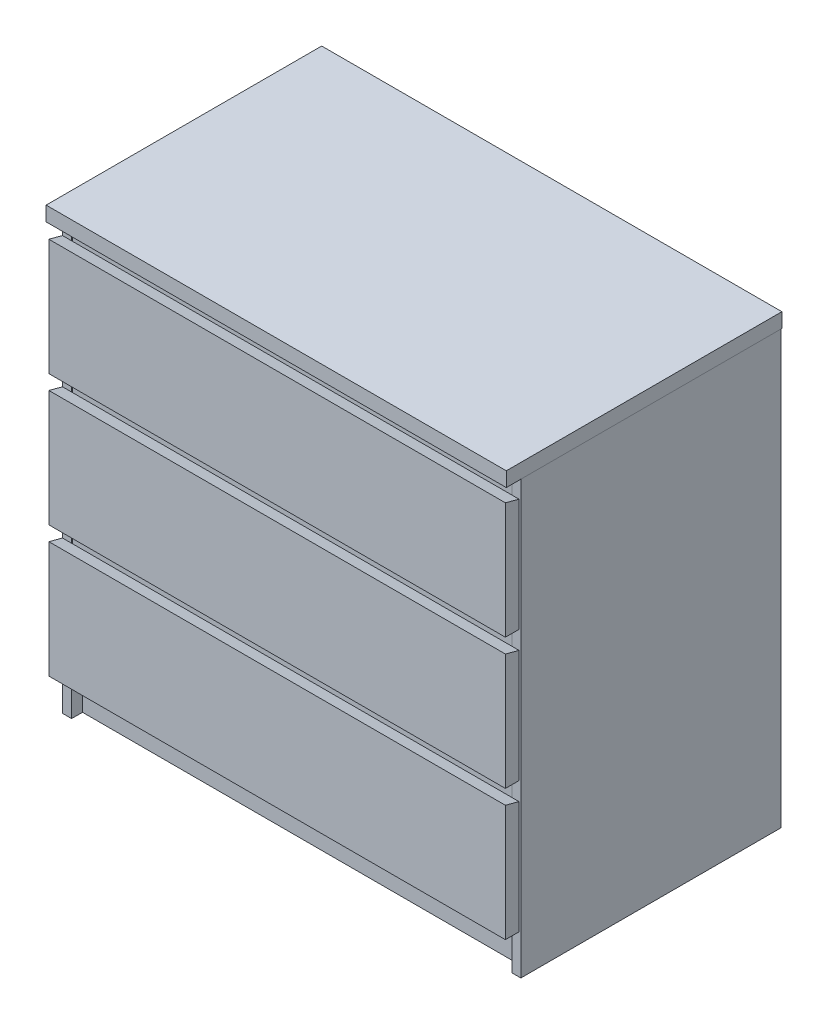
from build123d import *

# Parameters (mm, degrees)
BASESECTIONSIDESBOSS_EXTRUDE_DEPTH       = 69.85
BASESECTIONSIDESBOSS_EXTRUDE_2_DEPTH     = 69.85
PLANSKETCH_3_W                           = 768.35
PLANSKETCH_3_H                           = 15.875
BASEFACEEXTRUDE_THIN_DEPTH               = 69.85
F_1STLEVSIDESSECTIONBOSS_EXTRUDE_START   = 69.85
F_1STLEVSIDESSECTIONBOSS_EXTRUDE_DEPTH   = 228.6
F_1STLEVSIDESSECTIONBOSS_EXTRUDE_2_DEPTH = 228.6
F_1STLEVFRONTBAREXTRUDE_THIN_START       = 260.35
PLANSKETCH_5_W                           = 800.1
PLANSKETCH_5_H                           = 15.875
F_1STLEVFRONTBAREXTRUDE_THIN_DEPTH       = 38.1
DRAWERFACEBOSS_EXTRUDE_START             = 69.85
PLANSKETCH_6_W                           = 768.35
PLANSKETCH_6_H                           = 25.4
PLANSKETCH_6_W_2                         = 15.875
DRAWERFACEBOSS_EXTRUDE_DEPTH             = 203.2
POSITIONINGMOVE_FACE_BY                  = 1.5875
POSITIONINGMOVE_FACE_2_BY                = 1.5875
POSITIONINGMOVE_FACE_3_BY                = 1.5875
POSITIONINGMOVE_FACE_4_BY                = 1.5875
DRAWERPULLTOPMOVE_START                  = 263.746046868
DRAWERPULLTOPMOVE_FACE_OUTLINE_W         = 800
DRAWERPULLTOPMOVE_FACE_OUTLINE_H         = 27
DRAWERPULLTOPMOVE_FACE_DEPTH             = 6.163128512
BASEBACKBEAMBOSS_EXTRUDE_START           = 44.45
PLANSKETCH_8_W                           = 768.35
PLANSKETCH_8_H                           = 50.8
BASEBACKBEAMBOSS_EXTRUDE_DEPTH           = 15.875
DRAWERBODYBOSS_EXTRUDE_START             = 82.55
PLANSKETCH_9_W                           = 768.35
PLANSKETCH_9_H                           = 381
PLANSKETCH_9_H_2                         = 19.05
DRAWERBODYBOSS_EXTRUDE_DEPTH             = 158.75
DRAWERBODYSHELL_T                        = -12.7
DRAWERSIDESMOVE_FACE_BY                  = 3.175
DRAWERSIDESMOVE_FACE_2_BY                = 3.175
DRAWERSIDESMOVE_FACE_3_BY                = 3.175
DRAWERMERGEMOVE_START                    = -25.4
DRAWERMERGEMOVE_FACE_DEPTH               = 12.7
HEIGHTLPATTERN_COUNT                     = 3
HEIGHTLPATTERN_PITCH                     = 228.6
TOPBOARDBOSS_EXTRUDE_START               = 781.05
PLANSKETCH_10_W                          = 800.1
PLANSKETCH_10_H                          = 479.425
TOPBOARDBOSS_EXTRUDE_DEPTH               = 25.4
BACKBOARDEXTRUDE_THIN_START              = 44.45
PLANSKETCH_11_W                          = 768.35
PLANSKETCH_11_H                          = 1.5875
BACKBOARDEXTRUDE_THIN_DEPTH              = 711.2
TOPBOARDEXPANDMOVE_FACE_BY               = 1.5875
TOPBOARDEXPANDMOVE_FACE_2_BY             = 1.5875
TOPBOARDEXPANDMOVE_FACE_3_BY             = 1.5875


# Read off the part's stored shape, not the designer's step: DrawerPullTopMove Face, DrawerMergeMove Face
with BuildPart() as part:
    # PlanSketch → BaseSectionSidesBoss-Extrude (new body)
    with BuildSketch(Plane(origin=(0, 0, 0), x_dir=(1, 0, 0), z_dir=(0, 1, 0))):
        Polygon((800.1, 479.425), (784.225, 479.425), (784.225, 476.25), (784.225, 425.45), (784.225, 44.45), (784.225, 25.4), (800.1, 25.4), align=None)
    extrude(amount=BASESECTIONSIDESBOSS_EXTRUDE_DEPTH)



with BuildPart() as body_2:
    # PlanSketch → BaseSectionSidesBoss-Extrude 2 (new body)
    with BuildSketch(Plane(origin=(0, 0, 0), x_dir=(1, 0, 0), z_dir=(0, 1, 0))):
        Polygon((15.875, 476.25), (15.875, 479.425), (0, 479.425), (0, 25.4), (15.875, 25.4), (15.875, 44.45), (15.875, 425.45), align=None)
    extrude(amount=BASESECTIONSIDESBOSS_EXTRUDE_2_DEPTH)


with BuildPart() as part_1:
    add(part.part)

    add(body_2.part)  # BaseFaceExtrude-Thin merges body 2
    # PlanSketch<3> → BaseFaceExtrude-Thin (add)
    with BuildSketch(Plane(origin=(0, 0, 0), x_dir=(1, 0, 0), z_dir=(0, 1, 0))):
        with Locations((400.05, 52.3875)):
            Rectangle(PLANSKETCH_3_W, PLANSKETCH_3_H)
    extrude(amount=BASEFACEEXTRUDE_THIN_DEPTH)

    # PlanSketch<8> → BaseBackBeamBoss-Extrude (add)
    with BuildSketch(Plane(origin=(0, 0, 0), x_dir=(1, 0, 0), z_dir=(0, 1, 0)).offset(BASEBACKBEAMBOSS_EXTRUDE_START)):
        with Locations((400.05, 450.85)):
            Rectangle(PLANSKETCH_8_W, PLANSKETCH_8_H)
    extrude(amount=BASEBACKBEAMBOSS_EXTRUDE_DEPTH)


with BuildPart() as body_2_2:
    # PlanSketch<4> → 1stLevSidesSectionBoss-Extrude (new body)
    with BuildSketch(Plane(origin=(0, 0, 0), x_dir=(1, 0, 0), z_dir=(0, 1, 0)).offset(F_1STLEVSIDESSECTIONBOSS_EXTRUDE_START)):
        Polygon((15.875, 476.25), (15.875, 479.425), (0, 479.425), (0, 25.4), (15.875, 25.4), (15.875, 44.45), (15.875, 425.45), align=None)
    extrude(amount=F_1STLEVSIDESSECTIONBOSS_EXTRUDE_DEPTH)


with BuildPart() as body_3:
    # PlanSketch<4> → 1stLevSidesSectionBoss-Extrude 2 (new body)
    with BuildSketch(Plane(origin=(0, 0, 0), x_dir=(1, 0, 0), z_dir=(0, 1, 0)).offset(F_1STLEVSIDESSECTIONBOSS_EXTRUDE_START)):
        Polygon((800.1, 479.425), (784.225, 479.425), (784.225, 476.25), (784.225, 425.45), (784.225, 44.45), (784.225, 25.4), (800.1, 25.4), align=None)
    extrude(amount=F_1STLEVSIDESSECTIONBOSS_EXTRUDE_2_DEPTH)


with BuildPart() as body_4:
    # PlanSketch<5> → 1stLevFrontBarExtrude-Thin (new body)
    with BuildSketch(Plane(origin=(0, 0, 0), x_dir=(1, 0, 0), z_dir=(0, 1, 0)).offset(F_1STLEVFRONTBAREXTRUDE_THIN_START)):
        with Locations((400.05, 33.3375)):
            Rectangle(PLANSKETCH_5_W, PLANSKETCH_5_H)
    extrude(amount=F_1STLEVFRONTBAREXTRUDE_THIN_DEPTH)

    # PositioningMove Face 4: a face moved inward by 1.5875
    extrude(body_4.faces().sort_by_distance((400.05, 279.4, -25.4))[0], amount=POSITIONINGMOVE_FACE_4_BY, dir=(0, 0, -1), mode=Mode.SUBTRACT)


with BuildPart() as body_5:
    # PlanSketch<6> → DrawerFaceBoss-Extrude (new body)
    with BuildSketch(Plane(origin=(0, 0, 0), x_dir=(1, 0, 0), z_dir=(0, 1, 0)).offset(DRAWERFACEBOSS_EXTRUDE_START)):
        with Locations((400.05, 12.7)):
            Rectangle(PLANSKETCH_6_W, PLANSKETCH_6_H)
        with Locations((792.1625, 12.7)):
            Rectangle(PLANSKETCH_6_W_2, PLANSKETCH_6_H)
        with Locations((7.9375, 12.7)):
            Rectangle(PLANSKETCH_6_W_2, PLANSKETCH_6_H)
    extrude(amount=DRAWERFACEBOSS_EXTRUDE_DEPTH)

    # PositioningMove Face: a face moved inward by 1.5875
    extrude(body_5.faces().sort_by_distance((0, 171.45, -12.7))[0], amount=POSITIONINGMOVE_FACE_BY, dir=(1, 0, 0), mode=Mode.SUBTRACT)

    # PositioningMove Face 2: a face moved inward by 1.5875
    extrude(body_5.faces().sort_by_distance((800.1, 171.45, -12.7))[0], amount=POSITIONINGMOVE_FACE_2_BY, dir=(-1, 0, 0), mode=Mode.SUBTRACT)

    # PositioningMove Face 3: a face moved inward by 1.5875
    extrude(body_5.faces().sort_by_distance((400.05, 171.45, -25.4))[0], amount=POSITIONINGMOVE_FACE_3_BY, dir=(0, 0, 1), mode=Mode.SUBTRACT)

    # DrawerPullTopMove Face outline → DrawerPullTopMove Face (cut)
    with BuildSketch(Plane(origin=(0, 0, 0), x_dir=(1, 0, 0), z_dir=(0, 0.9659258262890682, -0.2588190451025211)).offset(DRAWERPULLTOPMOVE_START)):
        with Locations((400, -58.5)):
            Rectangle(DRAWERPULLTOPMOVE_FACE_OUTLINE_W, DRAWERPULLTOPMOVE_FACE_OUTLINE_H)
    extrude(amount=DRAWERPULLTOPMOVE_FACE_DEPTH, mode=Mode.SUBTRACT)


with BuildPart() as body_6:
    # PlanSketch<9> → DrawerBodyBoss-Extrude (new body)
    with BuildSketch(Plane(origin=(0, 0, 0), x_dir=(1, 0, 0), z_dir=(0, 1, 0)).offset(DRAWERBODYBOSS_EXTRUDE_START)):
        with Locations((400.05, 234.95)):
            Rectangle(PLANSKETCH_9_W, PLANSKETCH_9_H)
        with Locations((400.05, 34.925)):
            Rectangle(PLANSKETCH_9_W, PLANSKETCH_9_H_2)
    extrude(amount=DRAWERBODYBOSS_EXTRUDE_DEPTH)

    # DrawerBodyShell
    drawerbodyshell_openings = [body_6.faces().sort_by_distance(p)[0] for p in [
        (400.05, 241.3, -225.425),
        (400.05, 161.925, -25.4),
    ]]
    offset(amount=DRAWERBODYSHELL_T, openings=drawerbodyshell_openings, kind=Kind.INTERSECTION)

    # DrawerSidesMove Face: a face moved inward by 3.175
    extrude(body_6.faces().sort_by_distance((400.05, 161.925, -425.45))[0], amount=DRAWERSIDESMOVE_FACE_BY, dir=(0, 0, 1), mode=Mode.SUBTRACT)

    # DrawerSidesMove Face 2: a face moved inward by 3.175
    extrude(body_6.faces().sort_by_distance((15.875, 161.925, -225.425))[0], amount=DRAWERSIDESMOVE_FACE_2_BY, dir=(1, 0, 0), mode=Mode.SUBTRACT)

    # DrawerSidesMove Face 3: a face moved inward by 3.175
    extrude(body_6.faces().sort_by_distance((784.225, 161.925, -225.425))[0], amount=DRAWERSIDESMOVE_FACE_3_BY, dir=(-1, 0, 0), mode=Mode.SUBTRACT)

    # DrawerMergeMove Face outline → DrawerMergeMove Face (add)
    with BuildSketch(Plane.XY.offset(DRAWERMERGEMOVE_START)):
        Polygon((19.05, 241.3), (19.05, 82.55), (781.05, 82.55), (781.05, 241.3), (771.525, 241.3), (771.525, 95.25), (28.575, 95.25), (28.575, 241.3), align=None)
    extrude(amount=DRAWERMERGEMOVE_FACE_DEPTH)


with BuildPart() as body_3_1:
    add(body_3.part)

    # 1srLevelCombine: union body 4, body 2 2
    add(body_4.part)
    add(body_2_2.part)


with BuildPart() as body_5_1:
    add(body_5.part)

    # DrawerCombine: union body 6
    add(body_6.part)


with BuildPart() as heightlpattern_1:
    # HeightLPattern: pattern copy
    add(body_5_1.part.moved(Location(Vector(0, 1, 0) * (1 * HEIGHTLPATTERN_PITCH))))


with BuildPart() as heightlpattern_2:
    # HeightLPattern: pattern copy
    add(body_5_1.part.moved(Location(Vector(0, 1, 0) * (2 * HEIGHTLPATTERN_PITCH))))


with BuildPart() as heightlpattern_3:
    # HeightLPattern: pattern copy
    add(body_3_1.part.moved(Location(Vector(0, 1, 0) * (1 * HEIGHTLPATTERN_PITCH))))


with BuildPart() as heightlpattern_4:
    # HeightLPattern: pattern copy
    add(body_3_1.part.moved(Location(Vector(0, 1, 0) * (2 * HEIGHTLPATTERN_PITCH))))


with BuildPart() as body_8:
    # PlanSketch<10> → TopBoardBoss-Extrude (new body)
    with BuildSketch(Plane(origin=(0, 0, 0), x_dir=(1, 0, 0), z_dir=(0, 1, 0)).offset(TOPBOARDBOSS_EXTRUDE_START)):
        with Locations((400.05, 239.7125)):
            Rectangle(PLANSKETCH_10_W, PLANSKETCH_10_H)
    extrude(amount=-TOPBOARDBOSS_EXTRUDE_DEPTH)

    # TopBoardExpandMove Face: a face moved outward by 1.5875
    extrude(body_8.faces().sort_by_distance((400.05, 768.35, 0))[0], amount=TOPBOARDEXPANDMOVE_FACE_BY, dir=(0, 0, 1))

    # TopBoardExpandMove Face 2: a face moved outward by 1.5875
    extrude(body_8.faces().sort_by_distance((0, 768.35, -239.7125))[0], amount=TOPBOARDEXPANDMOVE_FACE_2_BY, dir=(-1, 0, 0))

    # TopBoardExpandMove Face 3: a face moved outward by 1.5875
    extrude(body_8.faces().sort_by_distance((800.1, 768.35, -239.7125))[0], amount=TOPBOARDEXPANDMOVE_FACE_3_BY, dir=(1, 0, 0))


with BuildPart() as body_9:
    # PlanSketch<11> → BackBoardExtrude-Thin (new body)
    with BuildSketch(Plane(origin=(0, 0, 0), x_dir=(1, 0, 0), z_dir=(0, 1, 0)).offset(BACKBOARDEXTRUDE_THIN_START)):
        with Locations((400.05, 477.04375)):
            Rectangle(PLANSKETCH_11_W, PLANSKETCH_11_H)
    extrude(amount=BACKBOARDEXTRUDE_THIN_DEPTH)


with BuildPart() as heightlpattern_4_1:
    add(heightlpattern_4.part)

    # 2W3HCombine: union HeightLPattern_3, body 3, part, body 8
    add(heightlpattern_3.part)
    add(body_3_1.part)
    add(part_1.part)
    add(body_8.part)


solid = Compound([body_5_1.part, heightlpattern_1.part, heightlpattern_2.part, body_9.part, heightlpattern_4_1.part])
